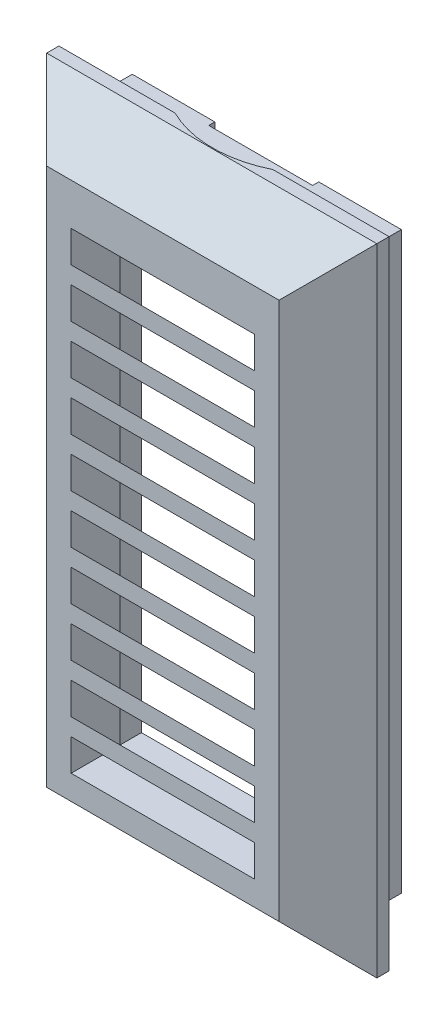
from build123d import *

# Parameters (mm, degrees)
SKETCH1_W               = 54
SKETCH1_H               = 104
SKETCH1_W_2             = 30
SKETCH1_H_2             = 80
BOSS_EXTRUDE1_DEPTH     = 8
CHAMFER1_SIZE           = 8
SKETCH2_W               = 54
SKETCH2_H               = 104
SKETCH2_W_2             = 50
SKETCH2_H_2             = 100
BOSS_EXTRUDE2_DEPTH     = 2
SKETCH3_W               = 44
SKETCH3_H               = 94
SKETCH3_W_2             = 41
SKETCH3_H_2             = 91
BOSS_EXTRUDE3_DEPTH     = 9
CUT_EXTRUDE1_REACH      = 106.581
SKETCH4_W               = 17
SKETCH4_H               = 1
CUT_EXTRUDE2_DEPTH      = 110.326033519
CUT_EXTRUDE2_DEPTH_BACK = 2
BOSS_EXTRUDE4_REACH     = 82.357


with BuildPart() as part:
    # Sketch1 → Boss-Extrude1 (new body)
    with BuildSketch(Plane.XY):
        with Locations((5.483558994, -15.912959381)):
            Rectangle(SKETCH1_W, SKETCH1_H)
        with Locations((5.483558994, -15.912959381)):
            Rectangle(SKETCH1_W_2, SKETCH1_H_2, mode=Mode.SUBTRACT)
    extrude(amount=BOSS_EXTRUDE1_DEPTH)

    # Chamfer1
    chamfer1_edges = [part.edges().sort_by_distance(p)[0] for p in [
        (-21.516441006, -15.912959381, 8),
        (5.483558994, 36.087040619, 8),
        (32.483558994, -15.912959381, 8),
        (5.483558994, -67.912959381, 8),
    ]]
    chamfer(chamfer1_edges, length=CHAMFER1_SIZE - 0.0001)  # a hair under: the kernel refuses the full size

    # Sketch2 → Boss-Extrude2 (add)
    with BuildSketch(Plane(origin=(0, 0, 0), x_dir=(-1, 0, 0), z_dir=(0, 0, -1))):
        with Locations((-5.483558994, -15.912959381)):
            Rectangle(SKETCH2_W, SKETCH2_H)
        with Locations((-5.483558994, -15.912959381)):
            Rectangle(SKETCH2_W_2, SKETCH2_H_2, mode=Mode.SUBTRACT)
    extrude(amount=BOSS_EXTRUDE2_DEPTH)

    # Sketch3 → Boss-Extrude3 (add)
    with BuildSketch(Plane(origin=(0, 0, 0), x_dir=(-1, 0, 0), z_dir=(0, 0, -1))):
        with Locations((-5.483558994, -15.912959381)):
            Rectangle(SKETCH3_W, SKETCH3_H)
        with Locations((-5.483558994, -15.912959381)):
            Rectangle(SKETCH3_W_2, SKETCH3_H_2, mode=Mode.SUBTRACT)
    extrude(amount=BOSS_EXTRUDE3_DEPTH)

    # Sketch4 → Cut-Extrude1 (cut, up to next)
    with BuildSketch(Plane(origin=(0, 31.087040619, 0), x_dir=(1, 0, 0), z_dir=(0, 1, 0)), mode=Mode.PRIVATE) as cut_extrude1_sk1:
        with Locations((5.483558994, 8.5)):
            Rectangle(SKETCH4_W, SKETCH4_H)
    cut_extrude1_tool1 = extrude(cut_extrude1_sk1.sketch, amount=-CUT_EXTRUDE1_REACH, mode=Mode.PRIVATE) & part.part
    add(cut_extrude1_tool1.solids().sort_by_distance((5.483559, 31.087041, -8.5))[0], mode=Mode.SUBTRACT)

    # Sketch5 → Cut-Extrude2 (cut, two sides: drawn at the far end of the back side and taken through both)
    with BuildSketch(Plane(origin=(0, 36.087040619, 0), x_dir=(1, 0, 0), z_dir=(0, 1, 0)).offset(-CUT_EXTRUDE2_DEPTH_BACK)):
        with BuildLine():
            Line((-76.690196685, 38.800488397), (-2.516441006, 2))
            ThreePointArc((-2.516441006, 2), (5.483558994, 0.124515497), (13.483558994, 2))
            Line((13.483558994, 2), (87.657314674, 38.800488397))
            Line((87.657314674, 38.800488397), (87.657314674, 204.402686182))
            Line((87.657314674, 204.402686182), (-76.690196685, 204.402686182))
            Line((-76.690196685, 204.402686182), (-76.690196685, 38.800488397))
        make_face()
    extrude(amount=CUT_EXTRUDE2_DEPTH + CUT_EXTRUDE2_DEPTH_BACK, mode=Mode.SUBTRACT)

    # Sketch6 → Boss-Extrude4 (add, up to next)
    with BuildSketch(Plane.ZY.offset(-20.483558994), mode=Mode.PRIVATE) as boss_extrude4_sk1:
        Polygon((0, -55.912959381), (8, -47.912959381), (8, -50.741386506), (2.828427125, -55.912959381), align=None)
    boss_extrude4_tool1 = extrude(boss_extrude4_sk1.sketch, amount=BOSS_EXTRUDE4_REACH, mode=Mode.PRIVATE) - part.part
    # Sketch6 → Boss-Extrude4 (add, up to next)
    with BuildSketch(Plane.ZY.offset(-20.483558994), mode=Mode.PRIVATE) as boss_extrude4_sk2:
        Polygon((0, -50.741386506), (8, -42.741386506), (8, -39.912959381), (0, -47.912959381), align=None)
    boss_extrude4_tool2 = extrude(boss_extrude4_sk2.sketch, amount=BOSS_EXTRUDE4_REACH, mode=Mode.PRIVATE) - part.part
    # Sketch6 → Boss-Extrude4 (add, up to next)
    with BuildSketch(Plane.ZY.offset(-20.483558994), mode=Mode.PRIVATE) as boss_extrude4_sk3:
        Polygon((0, -42.741386506), (0, -39.912959381), (8, -31.912959381), (8, -34.741386506), align=None)
    boss_extrude4_tool3 = extrude(boss_extrude4_sk3.sketch, amount=BOSS_EXTRUDE4_REACH, mode=Mode.PRIVATE) - part.part
    # Sketch6 → Boss-Extrude4 (add, up to next)
    with BuildSketch(Plane.ZY.offset(-20.483558994), mode=Mode.PRIVATE) as boss_extrude4_sk4:
        Polygon((0, -34.741386506), (0, -31.912959381), (8, -23.912959381), (8, -26.741386506), align=None)
    boss_extrude4_tool4 = extrude(boss_extrude4_sk4.sketch, amount=BOSS_EXTRUDE4_REACH, mode=Mode.PRIVATE) - part.part
    # Sketch6 → Boss-Extrude4 (add, up to next)
    with BuildSketch(Plane.ZY.offset(-20.483558994), mode=Mode.PRIVATE) as boss_extrude4_sk5:
        Polygon((0, -26.741386506), (0, -23.912959381), (8, -15.912959381), (8, -18.741386506), align=None)
    boss_extrude4_tool5 = extrude(boss_extrude4_sk5.sketch, amount=BOSS_EXTRUDE4_REACH, mode=Mode.PRIVATE) - part.part
    # Sketch6 → Boss-Extrude4 (add, up to next)
    with BuildSketch(Plane.ZY.offset(-20.483558994), mode=Mode.PRIVATE) as boss_extrude4_sk6:
        Polygon((0, -18.741386506), (0, -15.912959381), (8, -7.912959381), (8, -10.741386506), align=None)
    boss_extrude4_tool6 = extrude(boss_extrude4_sk6.sketch, amount=BOSS_EXTRUDE4_REACH, mode=Mode.PRIVATE) - part.part
    # Sketch6 → Boss-Extrude4 (add, up to next)
    with BuildSketch(Plane.ZY.offset(-20.483558994), mode=Mode.PRIVATE) as boss_extrude4_sk7:
        Polygon((0, -10.741386506), (0, -7.912959381), (8, 0.087040619), (8, -2.741386506), align=None)
    boss_extrude4_tool7 = extrude(boss_extrude4_sk7.sketch, amount=BOSS_EXTRUDE4_REACH, mode=Mode.PRIVATE) - part.part
    # Sketch6 → Boss-Extrude4 (add, up to next)
    with BuildSketch(Plane.ZY.offset(-20.483558994), mode=Mode.PRIVATE) as boss_extrude4_sk8:
        Polygon((0, -2.741386506), (0, 0.087040619), (8, 8.087040619), (8, 5.258613494), align=None)
    boss_extrude4_tool8 = extrude(boss_extrude4_sk8.sketch, amount=BOSS_EXTRUDE4_REACH, mode=Mode.PRIVATE) - part.part
    # Sketch6 → Boss-Extrude4 (add, up to next)
    with BuildSketch(Plane.ZY.offset(-20.483558994), mode=Mode.PRIVATE) as boss_extrude4_sk9:
        Polygon((0, 5.258613494), (0, 8.087040619), (8, 16.087040619), (8, 13.258613494), align=None)
    boss_extrude4_tool9 = extrude(boss_extrude4_sk9.sketch, amount=BOSS_EXTRUDE4_REACH, mode=Mode.PRIVATE) - part.part
    # Sketch6 → Boss-Extrude4 (add, up to next)
    with BuildSketch(Plane.ZY.offset(-20.483558994), mode=Mode.PRIVATE) as boss_extrude4_sk10:
        Polygon((8, 24.087040619), (8, 21.258613494), (0, 13.258613494), (0, 20.302668178), (3.784372441, 24.087040619), align=None)
    boss_extrude4_tool10 = extrude(boss_extrude4_sk10.sketch, amount=BOSS_EXTRUDE4_REACH, mode=Mode.PRIVATE) - part.part
    add(boss_extrude4_tool1.solids().sort_by_distance((20.483559, -52.569452, 4.656493))[0])
    add(boss_extrude4_tool2.solids().sort_by_distance((20.483559, -45.327173, 4))[0])
    add(boss_extrude4_tool3.solids().sort_by_distance((20.483559, -37.327173, 4))[0])
    add(boss_extrude4_tool4.solids().sort_by_distance((20.483559, -29.327173, 4))[0])
    add(boss_extrude4_tool5.solids().sort_by_distance((20.483559, -21.327173, 4))[0])
    add(boss_extrude4_tool6.solids().sort_by_distance((20.483559, -13.327173, 4))[0])
    add(boss_extrude4_tool7.solids().sort_by_distance((20.483559, -5.327173, 4))[0])
    add(boss_extrude4_tool8.solids().sort_by_distance((20.483559, 2.672827, 4))[0])
    add(boss_extrude4_tool9.solids().sort_by_distance((20.483559, 10.672827, 4))[0])
    add(boss_extrude4_tool10.solids().sort_by_distance((20.483559, 19.898628, 3.514255))[0])


solid = part.part
